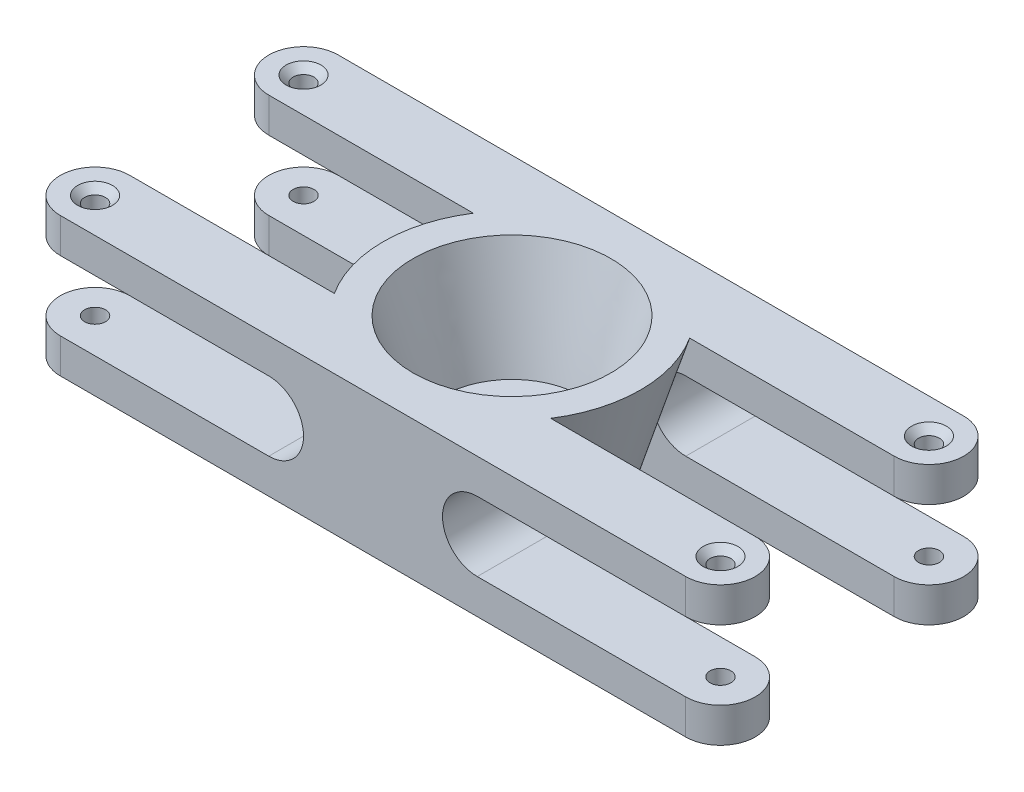
from build123d import *

# Parameters (mm, degrees)
BOSS_EXTRU_1_DEPTH        = 10
ESQUISSE9_R               = 1.5
ENL_V_MAT_EXTRU_1_DEPTH   = 51.249378106
ESQUISSE4_R               = 12.5
ESQUISSE3_R               = 18.5
SYM_TRIE3_COPY_1_DEPTH    = 10
SYM_TRIE3_COPY_2_SKETCH_R = 1.5
SYM_TRIE3_COPY_2_DEPTH    = 51.249378106
CHANFREIN1_SIZE           = 1
BOSS_EXTRU_2_DEPTH        = 10


with BuildPart() as part:
    # Esquisse1 → Boss.-Extru.1 (new body)
    with BuildSketch(Plane.XY):
        with BuildLine():
            Line((0, 0), (35, 0))
            Line((35, 0), (45, 0))
            Line((45, 0), (45, -20))
            Line((45, -20), (35, -20))
            Line((35, -20), (0, -20))
            Line((0, -20), (0, -15))
            Line((0, -15), (35, -15))
            ThreePointArc((35, -15), (40, -10), (35, -5))
            Line((35, -5), (0, -5))
            Line((0, -5), (0, 0))
        make_face()
    boss_extru_1 = extrude(amount=BOSS_EXTRU_1_DEPTH)

    # Esquisse9 → Enlèv. mat.-Extru.1 (cut, symmetric)
    with BuildSketch(Plane(origin=(0, 0, 0), x_dir=(1, 0, 0), z_dir=(0, 1, 0))):
        with BuildLine():
            ThreePointArc((0, -5), (1.464466094, -1.464466094), (5, 0))
            Line((5, 0), (0, 0))
            Line((0, 0), (0, -5))
        make_face()
        with BuildLine():
            ThreePointArc((5, -10), (1.464466094, -8.535533906), (0, -5))
            Line((0, -5), (0, -10))
            Line((0, -10), (5, -10))
        make_face()
        with Locations(Location((5, -5, 0), (0, 0, 270))):
            Circle(ESQUISSE9_R)
    enl_v_mat_extru_1 = extrude(amount=ENL_V_MAT_EXTRU_1_DEPTH, both=True, mode=Mode.SUBTRACT)

    # Esquisse4 → Lissage2 section 0
    with BuildSketch(Plane.XZ.offset(20)):
        with Locations((50, 20)):
            Circle(ESQUISSE4_R)
    # Esquisse3 → Lissage2 section 1
    with BuildSketch(Plane(origin=(0, 0, 0), x_dir=(1, 0, 0), z_dir=(0, 1, 0))):
        with Locations((50, -20)):
            Circle(ESQUISSE3_R)
    loft()

    # Symétrie2: Boss.-Extru.1, Enlèv. mat.-Extru.1 across plane
    add(boss_extru_1.mirror(Plane.XY.offset(20)))
    add(enl_v_mat_extru_1.mirror(Plane.XY.offset(20)), mode=Mode.SUBTRACT)

    # Symétrie3: Boss.-Extru.1, Enlèv. mat.-Extru.1 across plane
    add(boss_extru_1.mirror(Plane(origin=(50, 0, 0), x_dir=(0, 0, 1), z_dir=(1, 0, 0))))
    add(enl_v_mat_extru_1.mirror(Plane(origin=(50, 0, 0), x_dir=(0, 0, 1), z_dir=(1, 0, 0))), mode=Mode.SUBTRACT)

    # Symétrie3 copy 1 sketch → Symétrie3 copy 1 (add)
    with BuildSketch(Plane(origin=(100, 0, 40), x_dir=(-1, 0, 0), z_dir=(0, 0, -1))):
        with BuildLine():
            Line((0, 0), (35, 0))
            Line((35, 0), (45, 0))
            Line((45, 0), (45, -20))
            Line((45, -20), (35, -20))
            Line((35, -20), (0, -20))
            Line((0, -20), (0, -15))
            Line((0, -15), (35, -15))
            ThreePointArc((35, -15), (40, -10), (35, -5))
            Line((35, -5), (0, -5))
            Line((0, -5), (0, 0))
        make_face()
    extrude(amount=SYM_TRIE3_COPY_1_DEPTH)

    # Symétrie3 copy 2 sketch → Symétrie3 copy 2 (cut, symmetric)
    with BuildSketch(Plane(origin=(100, 0, 40), x_dir=(-1, 0, 0), z_dir=(0, 1, 0))):
        with BuildLine():
            ThreePointArc((0, -5), (1.464466094, -1.464466094), (5, 0))
            Line((5, 0), (0, 0))
            Line((0, 0), (0, -5))
        make_face()
        with BuildLine():
            ThreePointArc((5, -10), (1.464466094, -8.535533906), (0, -5))
            Line((0, -5), (0, -10))
            Line((0, -10), (5, -10))
        make_face()
        with Locations(Location((5, -5, 0), (0, 0, 270))):
            Circle(SYM_TRIE3_COPY_2_SKETCH_R)
    extrude(amount=SYM_TRIE3_COPY_2_DEPTH, both=True, mode=Mode.SUBTRACT)

    # Chanfrein1
    chanfrein1_edges = [part.edges().sort_by_distance(p)[0] for p in [
        (5, 0, 36.5),
        (95, 0, 36.5),
        (95, 0, 3.5),
        (5, 0, 3.5),
    ]]
    chamfer(chanfrein1_edges, length=CHANFREIN1_SIZE)


with BuildPart() as boss_extru_2_tool:
    # Esquisse10 → Boss.-Extru.2 (new body)
    with BuildSketch(Plane.ZY.offset(-55)):
        with BuildLine():
            Line((31.456439237, -20), (40, -20))
            Line((40, -20), (40, 0))
            Line((40, 0), (37.811513131, 0))
            add(Edge.make_bspline(
                [(37.811513131, 0), (36.770961966, -3.339421755), (35.724642409, -6.676958136), (33.611133104, -13.345209566), (32.544444679, -16.67608847), (31.456439237, -20)],
                knots=[0, 0, 0, 0, 0.5, 0.5, 1, 1, 1, 1], degree=3))
        make_face()
        with BuildLine():
            Line((0, -20), (8.543560763, -20))
            add(Edge.make_bspline(
                [(8.543560763, -20), (7.455555321, -16.67608847), (6.388866896, -13.345209566), (4.275357591, -6.676958136), (3.229038034, -3.339421755), (2.188486869, 0)],
                knots=[0, 0, 0, 0, 0.5, 0.5, 1, 1, 1, 1], degree=3))
            Line((2.188486869, 0), (0, 0))
            Line((0, 0), (0, -20))
        make_face()
    extrude(amount=BOSS_EXTRU_2_DEPTH)


with BuildPart() as part_1:
    add(part.part)


with BuildPart() as part_2:
    # Boss.-Extru.2: joined with boss_extru_2_tool
    add(part_1.part.fuse(boss_extru_2_tool.part, tol=0.00001))

    # Enlèvement de matière-Lissage1: read off the stored shape, not the designer's step
    # Enlèvement de matière-Lissage1: loft between two sections, ruled curve by curve
    enl_vement_de_mati_re_lissage1_from = [
        Edge.make_bspline([(40.172449115, -15, 18.150880317), (36.47420975, -15, 37.805982088), (56.12931152, -15, 41.504221453), (59.827550885, -15, 21.849119683), (63.52579025, -15, 2.194017912), (43.87068848, -15, -1.504221453), (40.172449115, -15, 18.150880317)], [0, 0, 0, 0, 0.5, 0.5, 0.5, 1, 1, 1, 1], 3, [1, 0.333333333, 0.333333333, 1, 0.333333333, 0.333333333, 1]),
    ]
    enl_vement_de_mati_re_lissage1_to = [
        Edge.make_bspline([(35.80353412, 0, 21.234040725), (38.271615569, 0, 49.626972485), (66.66454733, 0, 47.158891036), (64.19646588, 0, 18.765959275), (61.728384431, 0, -9.626972485), (33.33545267, 0, -7.158891036), (35.80353412, 0, 21.234040725)], [0, 0, 0, 0, 0.5, 0.5, 0.5, 1, 1, 1, 1], 3, [1, 0.333333333, 0.333333333, 1, 0.333333333, 0.333333333, 1]),
    ]
    enl_vement_de_mati_re_lissage1 = Solid(Shell([*[Face.make_surface_from_curves(enl_vement_de_mati_re_lissage1_from[k], enl_vement_de_mati_re_lissage1_to[k]) for k in range(1)], Face(Wire(enl_vement_de_mati_re_lissage1_from)), Face(Wire(enl_vement_de_mati_re_lissage1_to))]))
    add(enl_vement_de_mati_re_lissage1, mode=Mode.SUBTRACT)


solid = part_2.part
